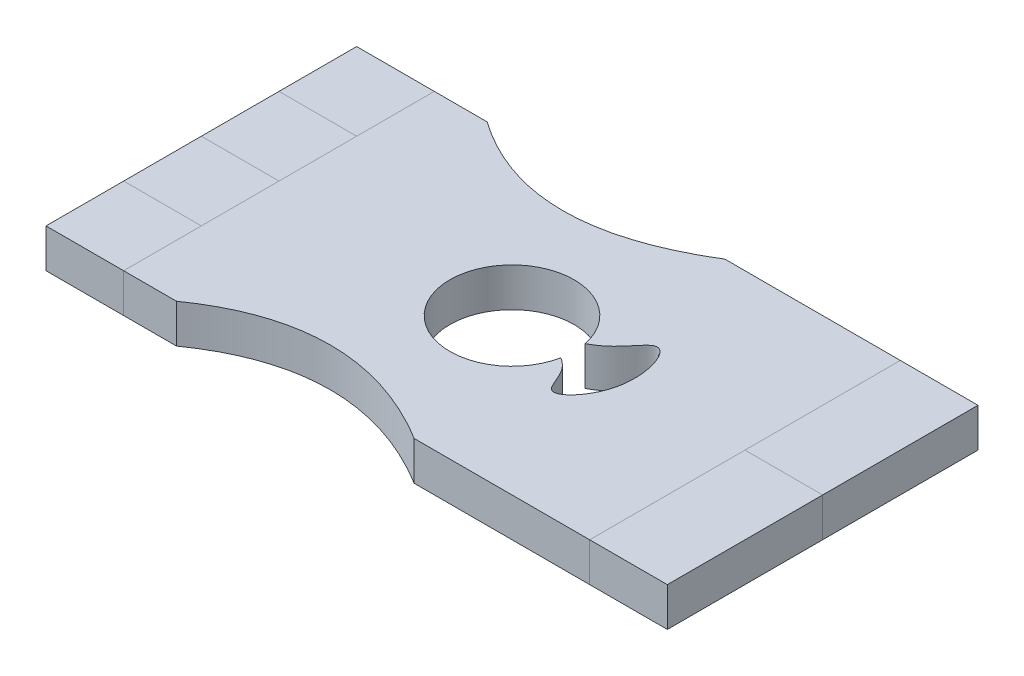
from build123d import *

# Parameters (mm, degrees)
SKETCH1_W           = 38.1
SKETCH1_H           = 25.4
SKETCH1_R           = 5.08
BOSS_EXTRUDE1_DEPTH = 3.175
SKETCH2_W           = 6.35
SKETCH2_H           = 3.175
BOSS_EXTRUDE3_DEPTH = 6.35
SKETCH2_4_W         = 6.35
SKETCH2_4_H         = 3.175
BOSS_EXTRUDE4_DEPTH = 6.35
SKETCH2_6_W         = 6.35
SKETCH2_6_H         = 3.175
BOSS_EXTRUDE6_DEPTH = 6.35
SKETCH2_7_W         = 6.35
SKETCH2_7_H         = 3.175
BOSS_EXTRUDE7_DEPTH = 6.35
SKETCH4_W           = 12.7
SKETCH4_H           = 3.175
BOSS_EXTRUDE8_DEPTH = 6.35
SKETCH4_3_W         = 12.7
SKETCH4_3_H         = 3.175
BOSS_EXTRUDE9_DEPTH = 6.35
CUT_EXTRUDE2_START  = -3.175
CUT_EXTRUDE2_DEPTH  = 3.175
CUT_EXTRUDE3_DEPTH  = 29.575000056


# Read off the part's stored shape, not the designer's step: Cut-Extrude2
with BuildPart() as part:
    # Sketch1 → Boss-Extrude1 (new body)
    with BuildSketch(Plane(origin=(0, 0, 0), x_dir=(1, 0, 0), z_dir=(0, 1, 0))):
        Rectangle(SKETCH1_W, SKETCH1_H)
        with Locations(Location((0, 0, 0), (0, 0, 270))):
            Circle(SKETCH1_R, mode=Mode.SUBTRACT)
    extrude(amount=BOSS_EXTRUDE1_DEPTH)

    # Cut-Extrude2 outline → Cut-Extrude2 (cut)
    with BuildSketch(Plane(origin=(0, 3.175, 0), x_dir=(1, 0, 0), z_dir=(0, 1, 0)).offset(CUT_EXTRUDE2_START)):
        with BuildLine():
            add(Edge.make_bspline(
                [(-14.734894962, -12.7), (-5.680324338, -6.31376032), (4.695493284, -12.7)],
                knots=[0, 0, 0, 1, 1, 1], degree=2))
            Line((-14.734894962, -12.7), (4.695493284, -12.7))
        make_face()
    cut_extrude2 = extrude(amount=CUT_EXTRUDE2_DEPTH, mode=Mode.SUBTRACT)

    # Mirror1: Cut-Extrude2 across plane
    add(cut_extrude2.mirror(Plane.XY), mode=Mode.SUBTRACT)

    # Sketch7 → Cut-Extrude3 (cut, through all)
    with BuildSketch(Plane(origin=(0, 3.175, 0), x_dir=(1, 0, 0), z_dir=(0, 1, 0))):
        with BuildLine():
            add(Edge.make_bspline(
                [(3.532104769, 0), (3.477676984, 0.390463167), (6.408378563, 1.270008565), (8.429115562, 5.608848412), (10.522151737, -0.769791386), (6.634495042, -4.966480622), (6.193967516, -1.079937843), (3.584000782, -0.372300314), (3.532104769, 0)],
                knots=[0, 0, 0, 0, 0.139904226, 0.304283653, 0.561817952, 0.737518598, 0.866603584, 1, 1, 1, 1], degree=3))
        make_face()
    extrude(amount=-CUT_EXTRUDE3_DEPTH, mode=Mode.SUBTRACT)


with BuildPart() as body_2:
    # Sketch2 → Boss-Extrude3 (new body)
    with BuildSketch(Plane.ZY.offset(19.05)):
        with Locations((-9.525, 1.5875)):
            Rectangle(SKETCH2_W, SKETCH2_H)
    extrude(amount=BOSS_EXTRUDE3_DEPTH)


with BuildPart() as body_3:
    # Sketch2<4> → Boss-Extrude4 (new body)
    with BuildSketch(Plane.ZY.offset(19.05)):
        with Locations((-3.175, 1.5875)):
            Rectangle(SKETCH2_4_W, SKETCH2_4_H)
    extrude(amount=BOSS_EXTRUDE4_DEPTH)


with BuildPart() as body_4:
    # Sketch2<6> → Boss-Extrude6 (new body)
    with BuildSketch(Plane.ZY.offset(19.05)):
        with Locations((3.175, 1.5875)):
            Rectangle(SKETCH2_6_W, SKETCH2_6_H)
    extrude(amount=BOSS_EXTRUDE6_DEPTH)


with BuildPart() as body_5:
    # Sketch2<7> → Boss-Extrude7 (new body)
    with BuildSketch(Plane.ZY.offset(19.05)):
        with Locations((9.525, 1.5875)):
            Rectangle(SKETCH2_7_W, SKETCH2_7_H)
    extrude(amount=BOSS_EXTRUDE7_DEPTH)


with BuildPart() as body_6:
    # Sketch4 → Boss-Extrude8 (new body)
    with BuildSketch(Plane(origin=(19.05, 0, 0), x_dir=(0, 0, -1), z_dir=(1, 0, 0))):
        with Locations((-6.35, 1.5875)):
            Rectangle(SKETCH4_W, SKETCH4_H)
    extrude(amount=BOSS_EXTRUDE8_DEPTH)


with BuildPart() as body_7:
    # Sketch4<3> → Boss-Extrude9 (new body)
    with BuildSketch(Plane(origin=(19.05, 0, 0), x_dir=(0, 0, -1), z_dir=(1, 0, 0))):
        with Locations((6.35, 1.5875)):
            Rectangle(SKETCH4_3_W, SKETCH4_3_H)
    extrude(amount=BOSS_EXTRUDE9_DEPTH)


solid = Compound([part.part, body_2.part, body_3.part, body_4.part, body_5.part, body_6.part, body_7.part])
